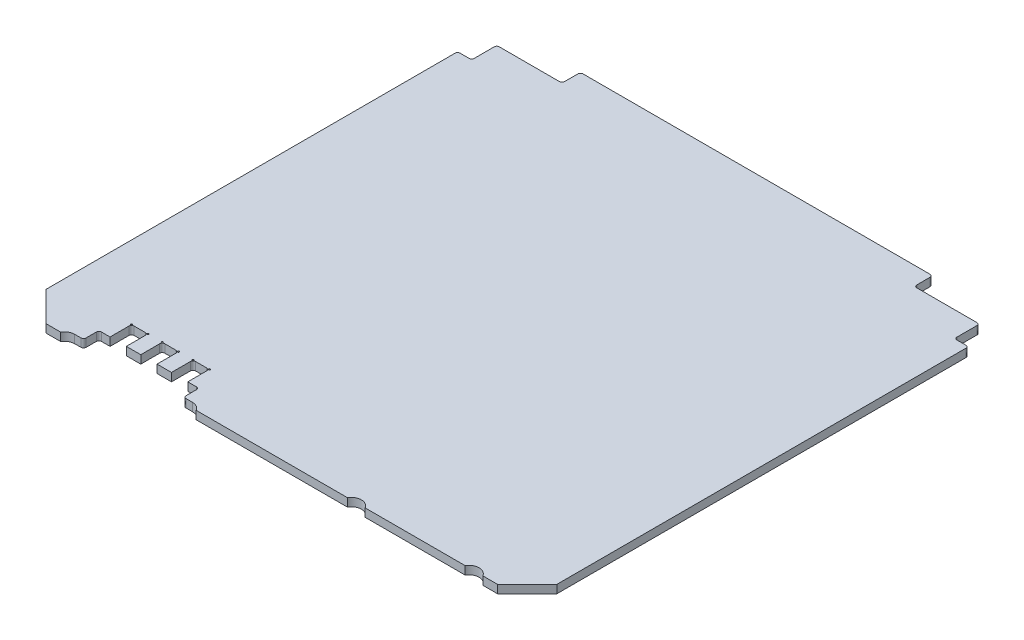
from build123d import *

# Parameters (mm, degrees)
GENERALSHAPE_DEPTH           = 0.8
ADDTOLERANCE_START           = -0.8
ADDTOLERANCE_DEPTH           = 1.6
BACKPLANE_DEPTH              = 71.573791169
BACKPLANE_DEPTH_BACK         = 71.573791169
RF_W                         = 3.18
RF_H                         = 4.2
CUT_EXTRUDE1_DEPTH           = 71.587392642
FILLET1_R                    = 0.5
F_0_32_0_32_DIAMETER_HOLE1_D = 0.32
FILLET2_R                    = 0.5
FILLET3_R                    = 0.5


# Read off the part's stored shape, not the designer's step: AddTolerance
with BuildPart() as part:
    # Sketch2 → GeneralShape (new, symmetric)
    with BuildSketch(Plane(origin=(0, 0, 0), x_dir=(1, 0, 0), z_dir=(0, 1, 0))):
        Polygon((47.25, 46.4), (34.5, 46.4), (34.5, 50), (-34.5, 50), (-34.5, 46.4), (-47.25, 46.4), (-47.25, 41.5), (-50, 41.5), (-50, -38.9), (-41.5, -47.4), (41.5, -47.4), (50, -38.9), (50, 41.5), (47.25, 41.5), align=None)
    extrude(amount=GENERALSHAPE_DEPTH, both=True)

    # AddTolerance outline → AddTolerance (cut)
    with BuildSketch(Plane(origin=(0, 0, 0), x_dir=(1, 0, 0), z_dir=(0, 1, 0)).offset(ADDTOLERANCE_START)):
        Polygon((49.9, 41.4), (49.9, -39), (50, -38.9), (50, 41.5), (47.25, 41.5), (47.25, 46.4), (34.5, 46.4), (34.5, 50), (-34.5, 50), (-34.5, 46.4), (-47.25, 46.4), (-47.25, 41.5), (-50, 41.5), (-50, -38.9), (-49.9, -39), (-49.9, 41.4), (-47.15, 41.4), (-47.15, 46.3), (-34.4, 46.3), (-34.4, 49.9), (34.4, 49.9), (34.4, 46.3), (47.15, 46.3), (47.15, 41.4), align=None)
    extrude(amount=ADDTOLERANCE_DEPTH, mode=Mode.SUBTRACT)

    # Sketch4 → Backplane (cut, two sides: drawn at the far end of the back side and taken through both)
    with BuildSketch(Plane(origin=(0, 0, 0), x_dir=(1, 0, 0), z_dir=(0, 1, 0)).offset(-BACKPLANE_DEPTH_BACK)):
        with BuildLine():
            Line((41.5, -47.4), (44.1, -44.8))
            Line((44.1, -44.8), (41.232050808, -44.8))
            ThreePointArc((41.232050808, -44.8), (39.5, -43.8), (37.767949192, -44.8))
            Line((37.767949192, -44.8), (18.232050808, -44.8))
            ThreePointArc((18.232050808, -44.8), (16.5, -43.8), (14.767949192, -44.8))
            Line((14.767949192, -44.8), (-14.767949192, -44.8))
            ThreePointArc((-14.767949192, -44.8), (-16.5, -43.8), (-18.232050808, -44.8))
            Line((-18.232050808, -44.8), (-37.767949192, -44.8))
            ThreePointArc((-37.767949192, -44.8), (-39.5, -43.8), (-41.232050808, -44.8))
            Line((-41.232050808, -44.8), (-44.1, -44.8))
            Line((-44.1, -44.8), (-41.5, -47.4))
            Line((-41.5, -47.4), (41.5, -47.4))
        make_face()
    extrude(amount=BACKPLANE_DEPTH + BACKPLANE_DEPTH_BACK, mode=Mode.SUBTRACT)

    # RF → Cut-Extrude1 (cut, through all)
    with BuildSketch(Plane(origin=(0, 0.8, 0), x_dir=(1, 0, 0), z_dir=(0, 1, 0))):
        with Locations((-22, -38.7)):
            Rectangle(RF_W, RF_H)
        with Locations((-28, -38.7)):
            Rectangle(RF_W, RF_H)
        with Locations((-34, -38.7)):
            Rectangle(RF_W, RF_H)
        with BuildLine():
            Line((-18.232050808, -40.8), (-20.41, -40.8))
            Line((-20.41, -40.8), (-23.59, -40.8))
            Line((-23.59, -40.8), (-26.41, -40.8))
            Line((-26.41, -40.8), (-29.59, -40.8))
            Line((-29.59, -40.8), (-32.41, -40.8))
            Line((-32.41, -40.8), (-35.59, -40.8))
            Line((-35.59, -40.8), (-37.767949192, -40.8))
            Line((-37.767949192, -40.8), (-37.767949192, -43.8))
            Line((-37.767949192, -43.8), (-39.5, -43.8))
            ThreePointArc((-39.5, -43.8), (-38.5, -44.067949192), (-37.767949192, -44.8))
            Line((-37.767949192, -44.8), (-18.232050808, -44.8))
            ThreePointArc((-18.232050808, -44.8), (-17.5, -44.067949192), (-16.5, -43.8))
            Line((-16.5, -43.8), (-18.232050808, -43.8))
            Line((-18.232050808, -43.8), (-18.232050808, -40.8))
        make_face()
    extrude(amount=-CUT_EXTRUDE1_DEPTH, mode=Mode.SUBTRACT)

    # Fillet1
    fillet1_edges = [part.edges().sort_by_distance(p)[0] for p in [
        (-23.59, 0, 36.6),
        (-20.41, 0, 36.6),
        (-18.232050808, 0, 40.8),
        (-18.232050808, 0, 43.8),
        (-37.767949192, 0, 43.8),
        (-37.767949192, 0, 40.8),
        (-35.59, 0, 36.6),
        (-32.41, 0, 36.6),
        (-29.59, 0, 36.6),
        (-26.41, 0, 36.6),
    ]]
    fillet(fillet1_edges, radius=FILLET1_R)

    # Ø0.32 (0.32) Diameter Hole1 (through all)
    with Locations(Plane(origin=(0, 0.8, 0), x_dir=(1, 0, 0), z_dir=(0, 1, 0))):
        with Locations((-20.41, -36.6), (-23.59, -36.6), (-26.41, -36.6), (-29.59, -36.6), (-32.41, -36.6), (-35.59, -36.6)):
            Hole(F_0_32_0_32_DIAMETER_HOLE1_D / 2)

    # Fillet2
    fillet2_edges = [part.edges().sort_by_distance(p)[0] for p in [
        (47.15, 0, -41.4),
        (47.15, 0, -46.3),
        (34.4, 0, -46.3),
        (-34.4, 0, -46.3),
        (-47.15, 0, -46.3),
        (-47.15, 0, -41.4),
    ]]
    fillet(fillet2_edges, radius=FILLET2_R)

    # Fillet3
    fillet3_edges = [part.edges().sort_by_distance(p)[0] for p in [
        (49.9, 0, -41.4),
        (34.4, 0, -49.9),
        (-34.4, 0, -49.9),
        (-49.9, 0, -41.4),
    ]]
    fillet(fillet3_edges, radius=FILLET3_R)


solid = part.part
